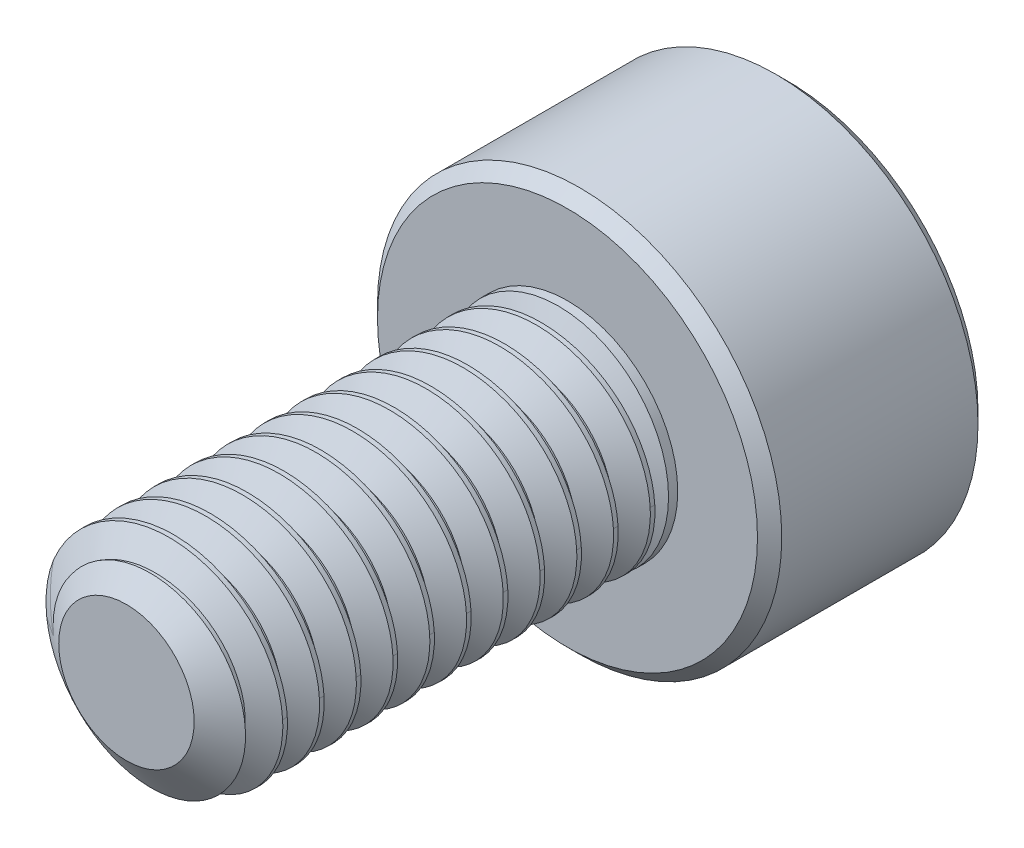
from build123d import *

# Parameters (mm, degrees)
SKETCH1_R          = 1.5
EXTRUDE1_DEPTH     = 6
CUT_SWEEP1_PITCH   = 0.5
SKETCH6_R          = 2.75
EXTRUDE2_DEPTH     = 3
CUT_EXTRUDE1_DEPTH = 1.875
CHAMFER1_SIZE      = 0.165


with BuildPart() as part:
    # Sketch1 → Extrude1 (new body)
    with BuildSketch(Plane.XY):
        Circle(SKETCH1_R)
    extrude(amount=-EXTRUDE1_DEPTH)

    # Cut-Sweep1: the profile of Sketch3 profile screwed along a right-hand helix of 13 turns, 6 arcs to a turn; built about Z, then put on its axis
    cut_sweep1_z = Axis((0, 0, 0), (0, 0, 1))
    cut_sweep1_corners = [(1.5003, 0, -0.437673205), (1.175240474, 0, -0.25), (1.175240474, 0, -0.1875), (1.5003, 0, 0.000173205)]
    with BuildLine(mode=Mode.PRIVATE) as cut_sweep1_profile:
        Line(cut_sweep1_corners[0], cut_sweep1_corners[1])
        Line(cut_sweep1_corners[1], cut_sweep1_corners[2])
        Line(cut_sweep1_corners[2], cut_sweep1_corners[3])
        Line(cut_sweep1_corners[3], cut_sweep1_corners[0])
    cut_sweep1_cap = Face(cut_sweep1_profile.wire())
    cut_sweep1_turn_angles = [0, 30, 60, 90, 120, 150, 180, 210, 240, 270, 300, 330, 360]
    cut_sweep1_turn_weights = [1, 0.8660254037844387, 1, 0.8660254037844387, 1, 0.8660254037844387, 1, 0.8660254037844387, 1, 0.8660254037844387, 1, 0.8660254037844387, 1]
    cut_sweep1_turn_rails = [Edge.make_bspline([Vector(p[0], p[1], 0).rotate(cut_sweep1_z, cut_sweep1_turn_angles[k]) / cut_sweep1_turn_weights[k] + Vector(0, 0, p[2] + CUT_SWEEP1_PITCH * cut_sweep1_turn_angles[k] / 360) for k in range(13)], [0, 0, 0, 1, 1, 2, 2, 3, 3, 4, 4, 5, 5, 6, 6, 6], 2, cut_sweep1_turn_weights) for p in cut_sweep1_corners]
    cut_sweep1_turn_sides = [Face.make_surface_from_curves(cut_sweep1_turn_rails[p[0]], cut_sweep1_turn_rails[p[1]]) for p in [(0, 1), (1, 2), (2, 3), (3, 0)]]
    cut_sweep1 = Plane(origin=(0, 0, 0), x_dir=(0, 1, 0), z_dir=(0, 0, -1)) * Solid(Shell([*[p.moved(Location((0, 0, CUT_SWEEP1_PITCH * i))) for i in range(13) for p in cut_sweep1_turn_sides], cut_sweep1_cap, cut_sweep1_cap.rotate(cut_sweep1_z, 4680).moved(Location((0, 0, CUT_SWEEP1_PITCH * 4680 / 360)))]))
    add(cut_sweep1, mode=Mode.SUBTRACT)

    # Sketch4 → Cut-Revolve1 (revolve, cut)
    with BuildSketch(Plane(origin=(0, 0, 0), x_dir=(0, 0, -1), z_dir=(1, 0, 0)), mode=Mode.PRIVATE) as cut_revolve1_sk:
        Polygon((0.405251783, 1.5), (0, 0.921240474), (0, 1.5), align=None)
    revolve(cut_revolve1_sk.sketch.rotate(Axis((0, 0, 0), (0, 0, -1)), 263.352109169), axis=Axis((0, 0, 0), (0, 0, -1)), mode=Mode.SUBTRACT)

    # Sketch6 → Extrude2 (add)
    with BuildSketch(Plane(origin=(0, 0, -6), x_dir=(-1, 0, 0), z_dir=(0, 0, -1))):
        Circle(SKETCH6_R)
    extrude(amount=EXTRUDE2_DEPTH)

    # Sketch7 → Cut-Extrude1 (cut)
    with BuildSketch(Plane(origin=(0, 0, -9), x_dir=(-1, 0, 0), z_dir=(0, 0, -1))):
        Polygon((0, 1.443375673), (-1.25, 0.721687836), (-1.25, -0.721687836), (0, -1.443375673), (1.25, -0.721687836), (1.25, 0.721687836), align=None)
    extrude(amount=-CUT_EXTRUDE1_DEPTH, mode=Mode.SUBTRACT)

    # Cut-Extrude2 cone 1 section (through the dimple's axis) → Cut-Extrude2 (revolve, cut)
    with BuildSketch(Plane(origin=(0, 0, -9), x_dir=(0, 1, 0), z_dir=(1, 0, 0))):
        Polygon((0, 0), (1.443375673, 0), (0, 1.443375673), align=None)
    revolve(axis=Axis((0, 0, -9), (0, 0, 1)), mode=Mode.SUBTRACT)

    # Chamfer1
    chamfer1_edges = [part.edges().sort_by_distance(p)[0] for p in [
        (2.75, 0, -6),
        (2.75, 0, -9),
    ]]
    chamfer(chamfer1_edges, length=CHAMFER1_SIZE)

    # Sketch10 → Revolve1 (revolve)
    with BuildSketch(Plane(origin=(0, 0, 0), x_dir=(0, 0, -1), z_dir=(1, 0, 0)), mode=Mode.PRIVATE) as revolve1_sk:
        Polygon((6, 1.5), (6, 0), (5.253679656, 0), (5.875, 1.5), align=None)
    revolve(revolve1_sk.sketch.rotate(Axis((0, 0, -6), (0, 0, 1)), 270), axis=Axis((0, 0, -6), (0, 0, 1)))


solid = part.part
